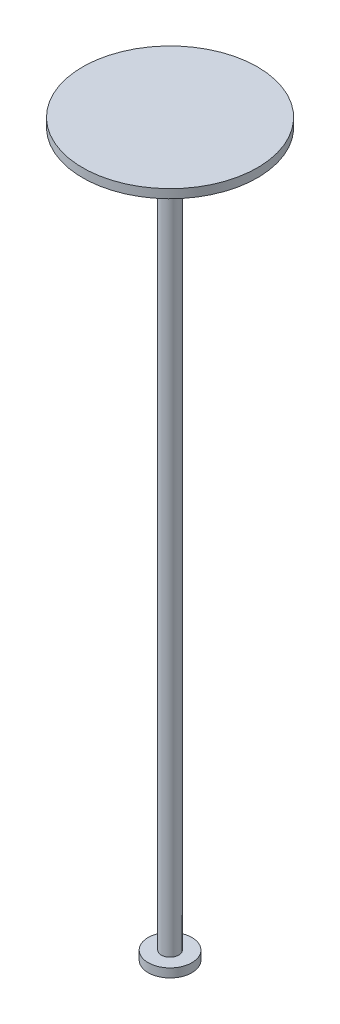
from build123d import *


with BuildPart() as part:
    # Sketch1 → Revolve1 (revolve)
    with BuildSketch(Plane.XY):
        Polygon((0, 0), (0, 207.156830829), (25.4, 207.156830829), (25.4, 204.616830829), (2.54, 204.616830829), (2.54, -2.393169171), (6.35, -2.393169171), (6.35, -4.933169171), (0, -4.933169171), align=None)
    revolve(axis=Axis((0, 0, 0), (0, 1, 0)))


solid = part.part
